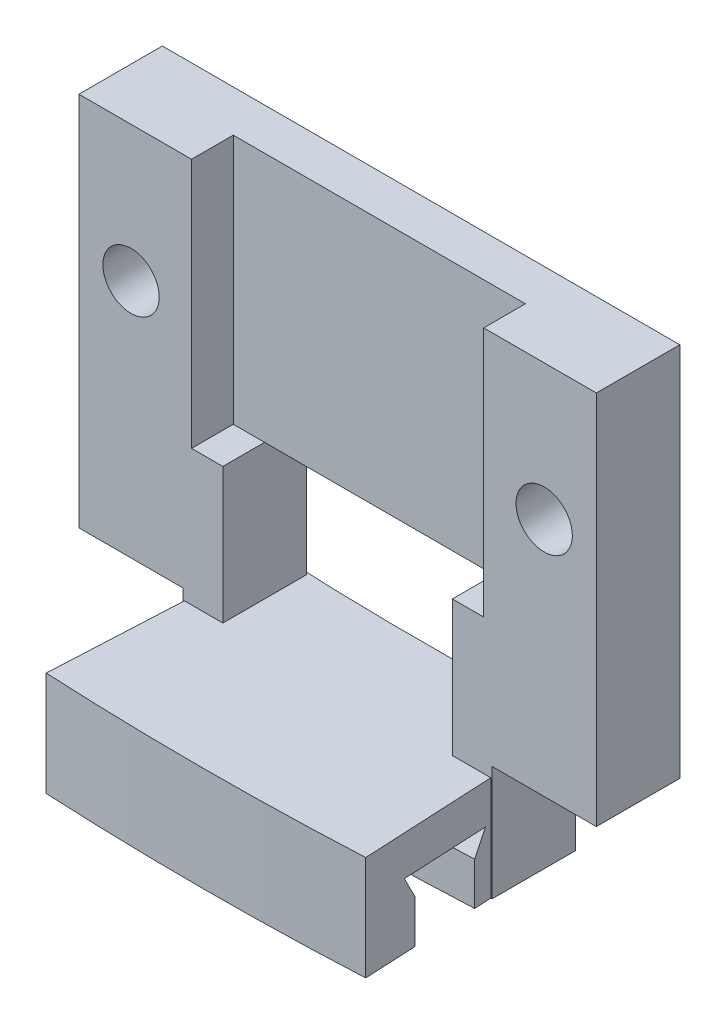
from build123d import *

# Parameters (mm, degrees)
MAIN_DEPTH           = 2
SKETCH8_R            = 1.35
HOLES_DEPTH          = 27.870243765
SKETCH9_W            = 14
SKETCH9_H            = 12
COMPONENTHOLES_DEPTH = 2
SUPPORT_ANGLE        = 5.7
SKETCH11_W           = 5
SKETCH11_H           = 5.5
SUPPORT_CUT_DEPTH    = 28.35434152


with BuildPart() as part:
    # Sketch7 → Main (new, symmetric)
    with BuildSketch(Plane.XY.offset(145.5)):
        Polygon((-12.4, 0), (-5.5, 0), (-5.5, 11.5), (5.5, 11.5), (5.5, 0), (12.4, 0), (12.4, 23.5), (-12.4, 23.5), align=None)
    extrude(amount=MAIN_DEPTH, both=True)

    # Sketch8 → Holes (cut, through all)
    with BuildSketch(Plane.XY.offset(147.5)):
        with Locations((-9.9, 17)):
            Circle(SKETCH8_R)
        with Locations((9.9, 17)):
            Circle(SKETCH8_R)
    extrude(amount=-HOLES_DEPTH, mode=Mode.SUBTRACT)

    # Sketch9 → ComponentHoles (cut)
    with BuildSketch(Plane.XY.offset(147.5)):
        with Locations((0, 17.5)):
            Rectangle(SKETCH9_W, SKETCH9_H)
    extrude(amount=-COMPONENTHOLES_DEPTH, mode=Mode.SUBTRACT)

    # Sketch11 → Support-Cut (cut, through all)
    with BuildSketch(Plane.XY.offset(147.5)):
        with Locations((-9.9, 2.75)):
            Rectangle(SKETCH11_W, SKETCH11_H)
        with Locations((9.9, 2.75)):
            Rectangle(SKETCH11_W, SKETCH11_H)
    extrude(amount=-SUPPORT_CUT_DEPTH, mode=Mode.SUBTRACT)


with BuildPart() as body_2:
    # Sketch10 → Support (revolve, symmetric)
    with BuildSketch(Plane(origin=(0, 0, 0), x_dir=(0, 0, -1), z_dir=(1, 0, 0))) as support_sk:
        Polygon((-147.95, 3.1), (-152.05, 3.1), (-151.5, 2.05), (-151.5, 0), (-154, 0), (-154, 5), (-143.5, 5), (-143.5, 0), (-148.5, 0), (-148.5, 2.05), align=None)
    revolve(axis=Axis((0, 11, 0), (0, -1, 0)), revolution_arc=SUPPORT_ANGLE / 2)
    revolve(support_sk.sketch, axis=Axis((0, 11, 0), (0, 1, 0)), revolution_arc=SUPPORT_ANGLE / 2)


solid = Compound([part.part, body_2.part])
